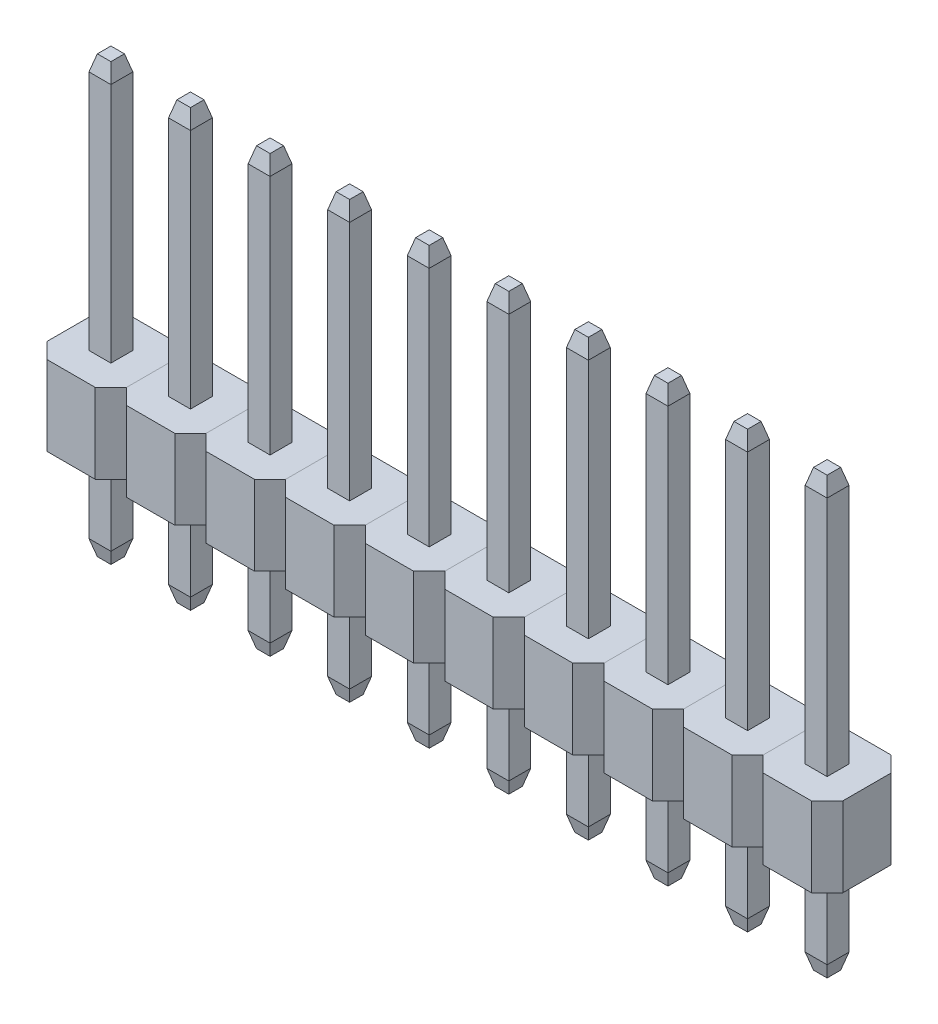
from build123d import *

# Parameters (mm, degrees)
SKETCH3_W           = 2.54
SKETCH3_H           = 2.54
SKETCH3_W_2         = 0.635
SKETCH3_H_2         = 0.635
BOSS_EXTRUDE1_DEPTH = 1.27
CHAMFER1_SIZE       = 0.5
BOSS_EXTRUDE2_START = -5.2
SKETCH5_W           = 0.7
SKETCH5_H           = 0.7
BOSS_EXTRUDE2_DEPTH = 12.9
SKETCH6_W           = 0.7
SKETCH6_H           = 0.7
BOSS_EXTRUDE3_DEPTH = 0.5
BOSS_EXTRUDE3_TAPER = 15
SKETCH7_W           = 0.7
SKETCH7_H           = 0.7
BOSS_EXTRUDE4_DEPTH = 0.5
BOSS_EXTRUDE4_TAPER = 15
LPATTERN1_COUNT     = 10
LPATTERN1_PITCH     = 2.54


with BuildPart() as part:
    # Sketch3 → Boss-Extrude1 (new, symmetric)
    with BuildSketch(Plane(origin=(0, 0, 0), x_dir=(1, 0, 0), z_dir=(0, 1, 0))):
        Rectangle(SKETCH3_W, SKETCH3_H)
        Rectangle(SKETCH3_W_2, SKETCH3_H_2, mode=Mode.SUBTRACT)
    extrude(amount=BOSS_EXTRUDE1_DEPTH, both=True)

    # Chamfer1
    chamfer1_edges = [part.edges().sort_by_distance(p)[0] for p in [
        (-1.27, 0, 1.27),
        (-1.27, 0, -1.27),
        (1.27, 0, -1.27),
        (1.27, 0, 1.27),
    ]]
    chamfer(chamfer1_edges, length=CHAMFER1_SIZE)


with BuildPart() as body_2:
    # Sketch5 → Boss-Extrude2 (new body)
    with BuildSketch(Plane(origin=(0, 1.27, 0), x_dir=(1, 0, 0), z_dir=(0, 1, 0)).offset(BOSS_EXTRUDE2_START)):
        Rectangle(SKETCH5_W, SKETCH5_H)
    extrude(amount=BOSS_EXTRUDE2_DEPTH)

    # Sketch6 → Boss-Extrude3 (add)
    with BuildSketch(Plane(origin=(0, 8.97, 0), x_dir=(1, 0, 0), z_dir=(0, 1, 0))):
        Rectangle(SKETCH6_W, SKETCH6_H)
    extrude(amount=BOSS_EXTRUDE3_DEPTH, taper=BOSS_EXTRUDE3_TAPER)

    # Sketch7 → Boss-Extrude4 (add)
    with BuildSketch(Plane.XZ.offset(3.93)):
        Rectangle(SKETCH7_W, SKETCH7_H)
    extrude(amount=BOSS_EXTRUDE4_DEPTH, taper=BOSS_EXTRUDE4_TAPER)


with BuildPart() as lpattern1_1:
    # LPattern1: pattern copy
    add(body_2.part.moved(Location(Vector(1, 0, 0) * (1 * LPATTERN1_PITCH))))


with BuildPart() as lpattern1_2:
    # LPattern1: pattern copy
    add(body_2.part.moved(Location(Vector(1, 0, 0) * (2 * LPATTERN1_PITCH))))


with BuildPart() as lpattern1_3:
    # LPattern1: pattern copy
    add(body_2.part.moved(Location(Vector(1, 0, 0) * (3 * LPATTERN1_PITCH))))


with BuildPart() as lpattern1_4:
    # LPattern1: pattern copy
    add(body_2.part.moved(Location(Vector(1, 0, 0) * (4 * LPATTERN1_PITCH))))


with BuildPart() as lpattern1_5:
    # LPattern1: pattern copy
    add(body_2.part.moved(Location(Vector(1, 0, 0) * (5 * LPATTERN1_PITCH))))


with BuildPart() as lpattern1_6:
    # LPattern1: pattern copy
    add(body_2.part.moved(Location(Vector(1, 0, 0) * (6 * LPATTERN1_PITCH))))


with BuildPart() as lpattern1_7:
    # LPattern1: pattern copy
    add(body_2.part.moved(Location(Vector(1, 0, 0) * (7 * LPATTERN1_PITCH))))


with BuildPart() as lpattern1_8:
    # LPattern1: pattern copy
    add(body_2.part.moved(Location(Vector(1, 0, 0) * (8 * LPATTERN1_PITCH))))


with BuildPart() as lpattern1_9:
    # LPattern1: pattern copy
    add(body_2.part.moved(Location(Vector(1, 0, 0) * (9 * LPATTERN1_PITCH))))


with BuildPart() as lpattern1_10:
    # LPattern1: pattern copy
    add(part.part.moved(Location(Vector(1, 0, 0) * (1 * LPATTERN1_PITCH))))


with BuildPart() as lpattern1_11:
    # LPattern1: pattern copy
    add(part.part.moved(Location(Vector(1, 0, 0) * (2 * LPATTERN1_PITCH))))


with BuildPart() as lpattern1_12:
    # LPattern1: pattern copy
    add(part.part.moved(Location(Vector(1, 0, 0) * (3 * LPATTERN1_PITCH))))


with BuildPart() as lpattern1_13:
    # LPattern1: pattern copy
    add(part.part.moved(Location(Vector(1, 0, 0) * (4 * LPATTERN1_PITCH))))


with BuildPart() as lpattern1_14:
    # LPattern1: pattern copy
    add(part.part.moved(Location(Vector(1, 0, 0) * (5 * LPATTERN1_PITCH))))


with BuildPart() as lpattern1_15:
    # LPattern1: pattern copy
    add(part.part.moved(Location(Vector(1, 0, 0) * (6 * LPATTERN1_PITCH))))


with BuildPart() as lpattern1_16:
    # LPattern1: pattern copy
    add(part.part.moved(Location(Vector(1, 0, 0) * (7 * LPATTERN1_PITCH))))


with BuildPart() as lpattern1_17:
    # LPattern1: pattern copy
    add(part.part.moved(Location(Vector(1, 0, 0) * (8 * LPATTERN1_PITCH))))


with BuildPart() as lpattern1_18:
    # LPattern1: pattern copy
    add(part.part.moved(Location(Vector(1, 0, 0) * (9 * LPATTERN1_PITCH))))


solid = Compound([part.part, body_2.part, lpattern1_1.part, lpattern1_2.part, lpattern1_3.part, lpattern1_4.part, lpattern1_5.part, lpattern1_6.part, lpattern1_7.part, lpattern1_8.part, lpattern1_9.part, lpattern1_10.part, lpattern1_11.part, lpattern1_12.part, lpattern1_13.part, lpattern1_14.part, lpattern1_15.part, lpattern1_16.part, lpattern1_17.part, lpattern1_18.part])
